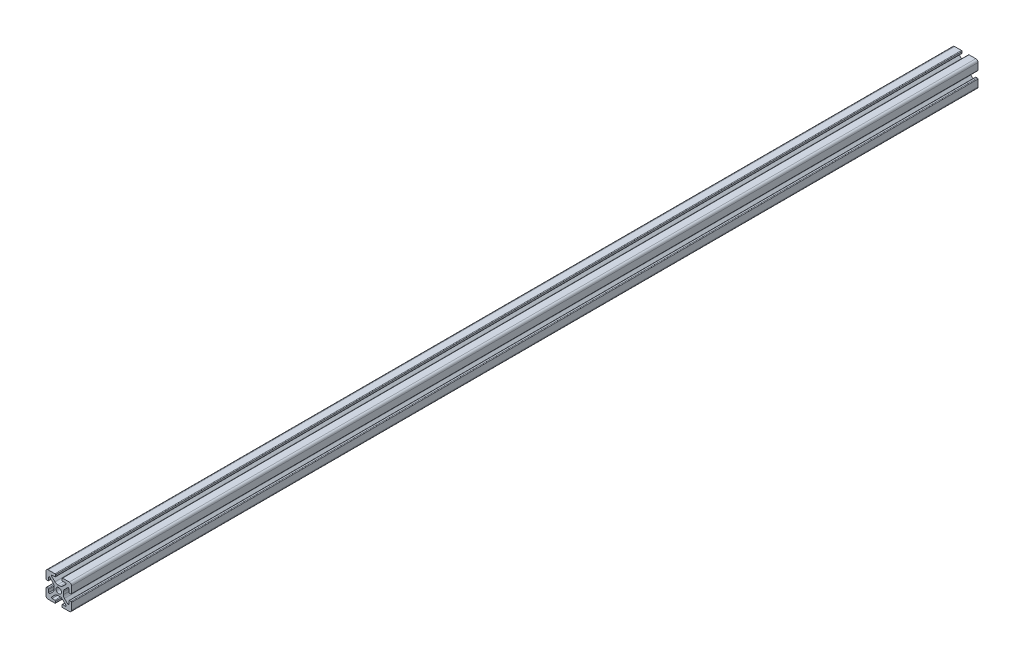
from build123d import *

# Parameters (mm, degrees)
BOSS_EXTRUDE1_DEPTH = 355.36


with BuildPart() as part:
    # Sketch4 → Boss-Extrude1 (new, symmetric)
    with BuildSketch(Plane.XY):
        with BuildLine():
            Line((3, -10), (8.25, -10))
            ThreePointArc((8.25, -10), (9.487436867, -9.487436867), (10, -8.25))
            Line((10, -8.25), (10, -3))
            ThreePointArc((10, -3), (9.853553391, -2.646446609), (9.5, -2.5))
            Line((9.5, -2.5), (8.424621202, -2.5))
            ThreePointArc((8.424621202, -2.5), (8.071067812, -2.646446609), (7.924621202, -3))
            Line((7.924621202, -3), (7.924621202, -5.25))
            ThreePointArc((7.924621202, -5.25), (7.615962919, -5.711939766), (7.071067812, -5.603553391))
            Line((7.071067812, -5.603553391), (4.478679656, -3.011165235))
            ThreePointArc((4.478679656, -3.011165235), (3.828361402, -2.037895189), (3.6, -0.889844892))
            Line((3.6, -0.889844892), (3.6, 0))
            Line((3.6, 0), (2.15, 0))
            ThreePointArc((2.15, 0), (1.52027958, -1.52027958), (0, -2.15))
            Line((0, -2.15), (0, -3.6))
            Line((0, -3.6), (0.889844892, -3.6))
            ThreePointArc((0.889844892, -3.6), (2.037895189, -3.828361402), (3.011165235, -4.478679656))
            Line((3.011165235, -4.478679656), (5.603553391, -7.071067812))
            ThreePointArc((5.603553391, -7.071067812), (5.711939766, -7.615962919), (5.25, -7.924621202))
            Line((5.25, -7.924621202), (3, -7.924621202))
            ThreePointArc((3, -7.924621202), (2.646446609, -8.071067812), (2.5, -8.424621202))
            Line((2.5, -8.424621202), (2.5, -9.5))
            ThreePointArc((2.5, -9.5), (2.646446609, -9.853553391), (3, -10))
        make_face()
    extrude(amount=BOSS_EXTRUDE1_DEPTH, both=True)

    # Mirror1: part across plane


with BuildPart() as part_1:
    add(part.part)
    add(part.part.mirror(Plane(origin=(0, 0, 0), x_dir=(0, 0, 1), z_dir=(1, 0, 0))))

    # Mirror2: part across plane


with BuildPart() as part_2:
    add(part_1.part)
    add(part_1.part.mirror(Plane.ZX))


solid = part_2.part
